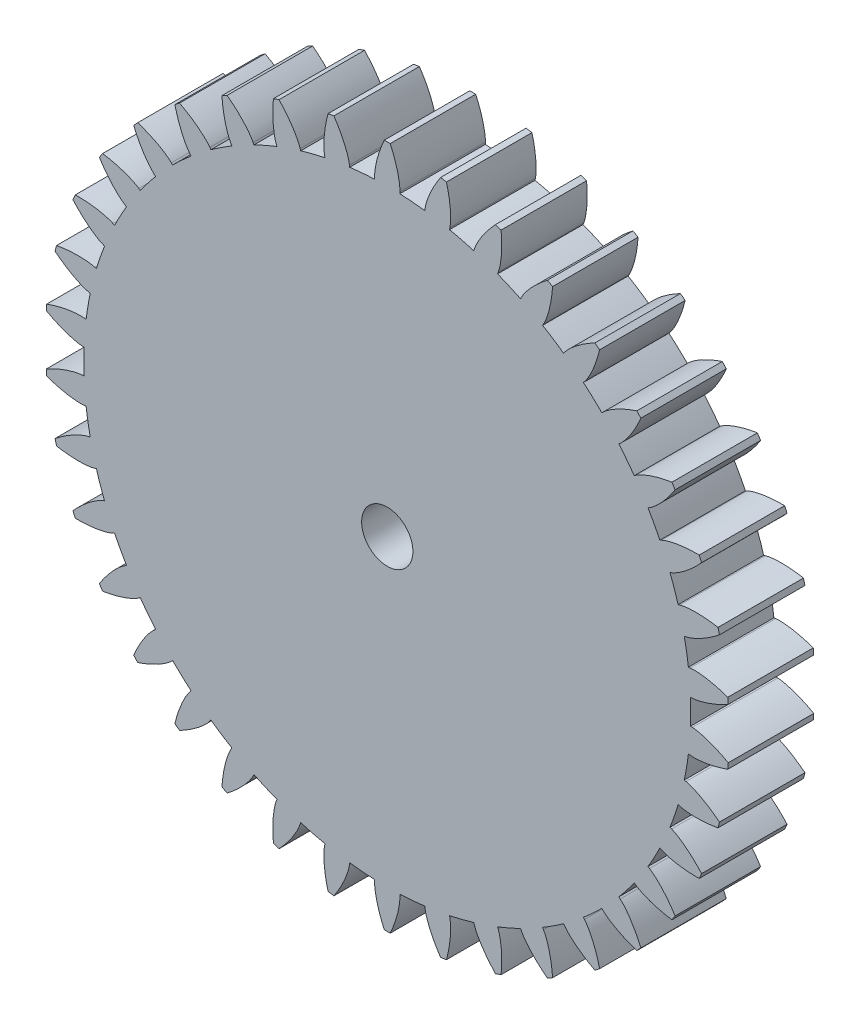
from build123d import *

# Parameters (mm, degrees)
SKETCH_1_R               = 4
SKETCH_1_R_2             = 1.5
EXTRUDE_1_DEPTH          = 5
CUT_EXTRUDE_1_DEPTH      = 8.549834435
PATTERN_CIRCULAR_1_COUNT = 6
PATTERN_CIRCULAR_1_ANGLE = 300
SKETCH_2_R               = 20
SKETCH_2_R_2             = 1.5
EXTRUDE_2_DEPTH          = 5
CUT_EXTRUDE_3_DEPTH      = 29.722813389
PATTERN_CIRCULAR_2_COUNT = 38


with BuildPart() as part:
    # 草图1 → 凸台-拉伸1 (new body)
    with BuildSketch(Plane.XY):
        Circle(SKETCH_1_R)
        Circle(SKETCH_1_R_2, mode=Mode.SUBTRACT)
    extrude(amount=EXTRUDE_1_DEPTH)

    # 草图1<3> → 切除-拉伸1 (cut, through all)
    with BuildSketch(Plane.XY):
        with BuildLine():
            Line((2.730540893, 0.700961074), (1.695038873, 0.435135863))
            ThreePointArc((1.695038873, 0.435135863), (1.736205349, 0.219296571), (1.75, 0))
            ThreePointArc((1.75, 0), (1.736205349, -0.219296571), (1.695038873, -0.435135863))
            Line((1.695038873, -0.435135863), (2.730540893, -0.700961074))
            add(Edge.make_bspline(
                [(2.730540893, -0.700961074), (2.751355068, -0.706304311), (2.808329953, -0.725541446), (2.910522768, -0.778982289), (3.06267796, -0.887491262), (3.235956594, -1.057334282), (3.408810129, -1.2831446), (3.52264255, -1.482702951), (3.589508983, -1.625182096), (3.620975996, -1.699568426)],
                knots=[0, 0, 0, 0, 0, 0.005604068, 0.015718248, 0.029959916, 0.048733667, 0.068727063, 0.089838728, 0.089838728, 0.089838728, 0.089838728, 0.089838728], degree=4))
            ThreePointArc((3.620975996, -1.699568426), (3.90409426, -0.870659525), (4, 0))
            ThreePointArc((4, 0), (3.90409426, 0.870659525), (3.620975996, 1.699568426))
            add(Edge.make_bspline(
                [(2.730540893, 0.700961074), (2.751355068, 0.706304311), (2.808329953, 0.725541446), (2.910522768, 0.778982289), (3.06267796, 0.887491262), (3.235956594, 1.057334282), (3.408810129, 1.2831446), (3.52264255, 1.482702951), (3.589508983, 1.625182096), (3.620975996, 1.699568426)],
                knots=[0, 0, 0, 0, 0, 0.005604068, 0.015718248, 0.029959916, 0.048733667, 0.068727063, 0.089838728, 0.089838728, 0.089838728, 0.089838728, 0.089838728], degree=4))
        make_face()
    cut_extrude_1 = extrude(amount=CUT_EXTRUDE_1_DEPTH, mode=Mode.SUBTRACT)

    # 阵列(圆周)1: 切除-拉伸1 ×6 about axis
    pattern_circular_1_axis = Axis((0, 0, 5), (0, 0, 1))
    for i in range(1, PATTERN_CIRCULAR_1_COUNT):
        add(cut_extrude_1.rotate(pattern_circular_1_axis, i * PATTERN_CIRCULAR_1_ANGLE / (PATTERN_CIRCULAR_1_COUNT - 1)), mode=Mode.SUBTRACT)

    # 草图2 → 凸台-拉伸2 (add)
    with BuildSketch(Plane.XY.offset(5)):
        Circle(SKETCH_2_R)
        Circle(SKETCH_2_R_2, mode=Mode.SUBTRACT)
    extrude(amount=EXTRUDE_2_DEPTH)

    # 草图2<3> → 切除-拉伸3 (cut, through all)
    with BuildSketch(Plane.XY.offset(5)):
        with BuildLine():
            Line((17.838908029, 0.737822694), (17.734837211, 0.733518293))
            ThreePointArc((17.734837211, 0.733518293), (17.746208898, 0.366837497), (17.75, 0))
            ThreePointArc((17.75, 0), (17.746208898, -0.366837497), (17.734837211, -0.733518293))
            Line((17.734837211, -0.733518293), (17.838908029, -0.737822694))
            add(Edge.make_bspline(
                [(17.838908029, -0.737822694), (17.872849269, -0.739226514), (17.940552494, -0.744118754), (18.075241986, -0.762138409), (18.328810536, -0.812273342), (18.66347973, -0.90508771), (19.120548858, -1.070237387), (19.508851941, -1.247313895), (19.778857482, -1.386865325), (19.937601681, -1.474433608), (19.945263252, -1.478672992)],
                knots=[0, 0, 0, 0, 0, 0.001401017, 0.002802034, 0.005604068, 0.010661158, 0.015718248, 0.022839082, 0.023200461, 0.023200461, 0.023200461, 0.023200461, 0.023200461], degree=4))
            ThreePointArc((19.945263252, -1.478672992), (19.986311128, -0.739842877), (20, 0))
            ThreePointArc((20, 0), (19.986311128, 0.739842877), (19.945263252, 1.478672992))
            add(Edge.make_bspline(
                [(17.838908029, 0.737822694), (17.872849269, 0.739226514), (17.940552494, 0.744118754), (18.075241986, 0.762138409), (18.328810536, 0.812273342), (18.66347973, 0.90508771), (19.120548858, 1.070237387), (19.508851941, 1.247313895), (19.778857482, 1.386865325), (19.937601681, 1.474433608), (19.945263252, 1.478672992)],
                knots=[0, 0, 0, 0, 0, 0.001401017, 0.002802034, 0.005604068, 0.010661158, 0.015718248, 0.022839082, 0.023200461, 0.023200461, 0.023200461, 0.023200461, 0.023200461], degree=4))
        make_face()
    cut_extrude_3 = extrude(amount=CUT_EXTRUDE_3_DEPTH, mode=Mode.SUBTRACT)

    # 阵列(圆周)2: 切除-拉伸3 ×38 about axis
    pattern_circular_2_axis = Axis((0, 0, 10), (0, 0, 1))
    for i in range(1, PATTERN_CIRCULAR_2_COUNT):
        add(cut_extrude_3.rotate(pattern_circular_2_axis, i * 360 / PATTERN_CIRCULAR_2_COUNT), mode=Mode.SUBTRACT)


solid = part.part
